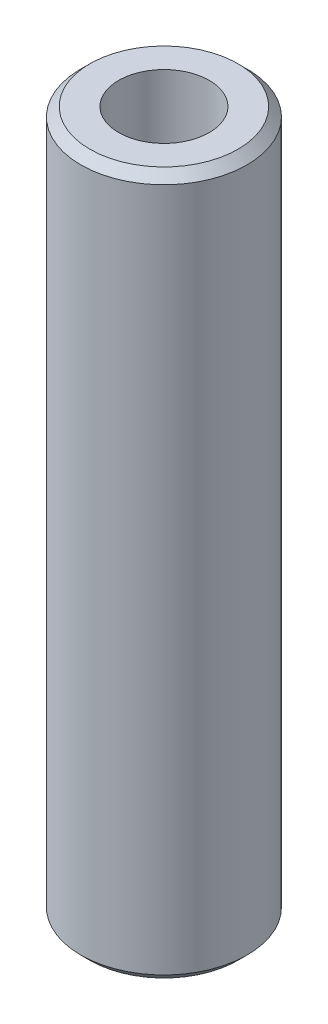
from build123d import *

# Parameters (mm, degrees)
SKETCH1_R           = 55
BOSS_EXTRUDE1_DEPTH = 464.777783749
SKETCH2_R           = 29.962895061
CUT_EXTRUDE1_DEPTH  = 472.241326994
CHAMFER1_SIZE       = 5.982283755


with BuildPart() as part:
    # Sketch1 → Boss-Extrude1 (new body)
    with BuildSketch(Plane(origin=(0, 0, 0), x_dir=(1, 0, 0), z_dir=(0, 1, 0))):
        Circle(SKETCH1_R)
    extrude(amount=BOSS_EXTRUDE1_DEPTH)

    # Sketch2 → Cut-Extrude1 (cut, through all)
    with BuildSketch(Plane(origin=(0, 0, 0), x_dir=(1, 0, 0), z_dir=(0, 1, 0))):
        Circle(SKETCH2_R)
    extrude(amount=CUT_EXTRUDE1_DEPTH, mode=Mode.SUBTRACT)

    # Chamfer1
    chamfer1_edges = [part.edges().sort_by_distance(p)[0] for p in [
        (-55, 464.777783749, 0),
        (-55, 0, 0),
    ]]
    chamfer(chamfer1_edges, length=CHAMFER1_SIZE)


solid = part.part
